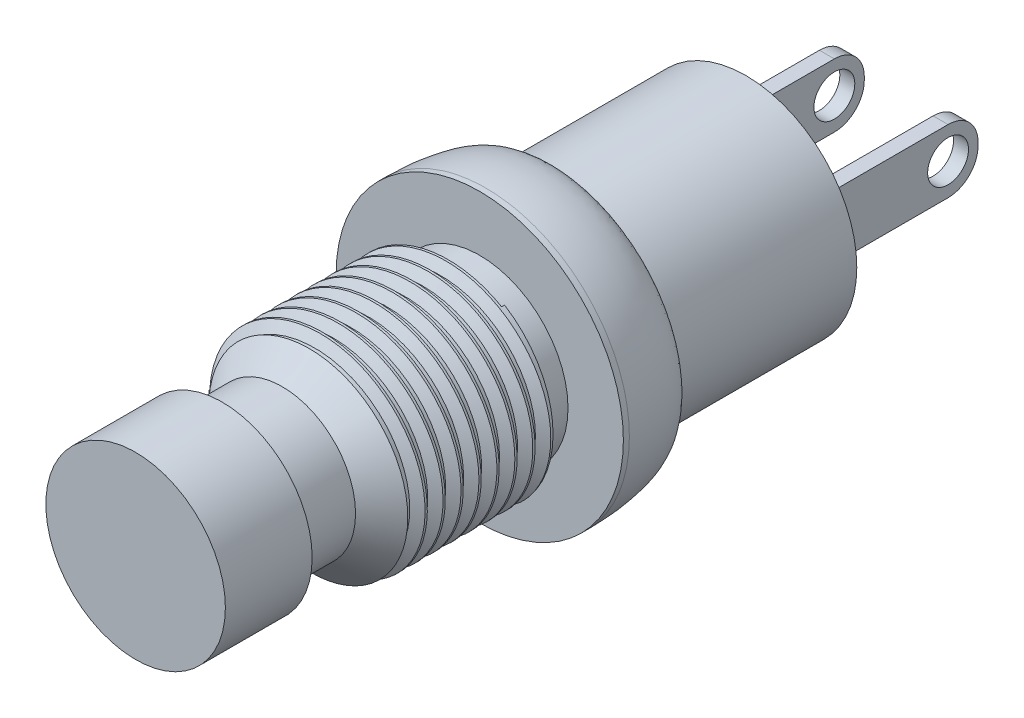
from build123d import *

# Parameters (mm, degrees)
SKETCH1_R           = 3.7
BOSS_EXTRUDE1_DEPTH = 6.5
SKETCH2_R           = 4.8
BOSS_EXTRUDE2_DEPTH = 2.4
FILLET1_SIZE        = 2.2
FILLET1_SIZE_2      = 0.5
SKETCH3_R           = 3.45
BOSS_EXTRUDE3_DEPTH = 6.6
CHAMFER1_SIZE       = 1
SKETCH9_R           = 2.45
BOSS_EXTRUDE4_DEPTH = 2
THREAD1_PITCH       = 0.6
SKETCH10_R          = 3.45
SKETCH10_R_2        = 2.95
CUT_EXTRUDE1_DEPTH  = 1
SKETCH11_R          = 3
BOSS_EXTRUDE5_DEPTH = 2.9
SKETCH12_W          = 0.5
SKETCH12_H          = 2.12
BOSS_EXTRUDE6_DEPTH = 5.6
FILLET2_R           = 1
SKETCH13_R          = 0.682843031
CUT_EXTRUDE2_DEPTH  = 5.6


with BuildPart() as part:
    # Sketch1 → Boss-Extrude1 (new body)
    with BuildSketch(Plane.XY):
        with Locations(Location((0, 0, 0), (0, 0, 180))):
            Circle(SKETCH1_R)
    extrude(amount=BOSS_EXTRUDE1_DEPTH)

    # Sketch2 → Boss-Extrude2 (add)
    with BuildSketch(Plane.XY.offset(6.5)):
        Circle(SKETCH2_R)
    extrude(amount=BOSS_EXTRUDE2_DEPTH)

    # Fillet1
    # an asymmetric fillet: 2.2, 0.5 mm, written as the material it takes off along each edge
    with BuildSketch(Plane(origin=(0, 0, 6.5), x_dir=(1, 0, 0), z_dir=(0, -1, 0))) as fillet1_piece_1:
        with BuildLine():
            Bezier((4.8, FILLET1_SIZE), (4.8, 0), (4.8 - FILLET1_SIZE_2, 0), weights=[1, 0.707106781, 1])
            Line((4.8 - FILLET1_SIZE_2, 0), (4.8, 0))
            Line((4.8, 0), (4.8, FILLET1_SIZE))
        make_face()
    revolve(axis=Axis((0, 0, 6.5), (0, 0, 1)), mode=Mode.SUBTRACT)

    # Sketch3 → Boss-Extrude3 (add)
    with BuildSketch(Plane.XY.offset(8.9)):
        Circle(SKETCH3_R)
    extrude(amount=BOSS_EXTRUDE3_DEPTH)

    # Chamfer1
    chamfer1_edges = [part.edges().sort_by_distance(p)[0] for p in [
        (-3.45, 0, 15.5),
    ]]
    chamfer(chamfer1_edges, length=CHAMFER1_SIZE)

    # Sketch9 → Boss-Extrude4 (add)
    with BuildSketch(Plane.XY.offset(15.5)):
        Circle(SKETCH9_R)
    extrude(amount=BOSS_EXTRUDE4_DEPTH)

    # Thread1: the profile of Thread Profile1 profile screwed along a right-hand helix of 8.333333 turns, 6 arcs to a turn; built about Z, then put on its axis
    thread1_z = Axis((0, 0, 0), (0, 0, 1))
    thread1_corners = [(3.4503, -1e-09, -0.000173205), (3.4503, -1e-09, 0.525173203), (3.125240475, -1e-09, 0.337499999), (3.125240475, -1e-09, 0.187499999)]
    with BuildLine(mode=Mode.PRIVATE) as thread1_profile:
        Line(thread1_corners[0], thread1_corners[1])
        Line(thread1_corners[1], thread1_corners[2])
        Line(thread1_corners[2], thread1_corners[3])
        Line(thread1_corners[3], thread1_corners[0])
    thread1_cap = Face(thread1_profile.wire())
    thread1_turn_angles = [0, 30, 60, 90, 120, 150, 180, 210, 240, 270, 300, 330, 360]
    thread1_turn_weights = [1, 0.8660254037844387, 1, 0.8660254037844387, 1, 0.8660254037844387, 1, 0.8660254037844387, 1, 0.8660254037844387, 1, 0.8660254037844387, 1]
    thread1_turn_rails = [Edge.make_bspline([Vector(p[0], p[1], 0).rotate(thread1_z, thread1_turn_angles[k]) / thread1_turn_weights[k] + Vector(0, 0, p[2] + THREAD1_PITCH * thread1_turn_angles[k] / 360) for k in range(13)], [0, 0, 0, 1, 1, 2, 2, 3, 3, 4, 4, 5, 5, 6, 6, 6], 2, thread1_turn_weights) for p in thread1_corners]
    thread1_turn_sides = [Face.make_surface_from_curves(thread1_turn_rails[p[0]], thread1_turn_rails[p[1]]) for p in [(0, 1), (1, 2), (2, 3), (3, 0)]]
    thread1_last_angles = [2880, 2910, 2940, 2970, 3000]
    thread1_last_weights = [1, 0.8660254037844387, 1, 0.8660254037844387, 1]
    thread1_last_rails = [Edge.make_bspline([Vector(p[0], p[1], 0).rotate(thread1_z, thread1_last_angles[k]) / thread1_last_weights[k] + Vector(0, 0, p[2] + THREAD1_PITCH * thread1_last_angles[k] / 360) for k in range(5)], [0, 0, 0, 1, 1, 2, 2, 2], 2, thread1_last_weights) for p in thread1_corners]
    thread1_last_sides = [Face.make_surface_from_curves(thread1_last_rails[p[0]], thread1_last_rails[p[1]]) for p in [(0, 1), (1, 2), (2, 3), (3, 0)]]
    thread1 = Plane(origin=(0, 0, 15), x_dir=(-0.999390827, 0.034899497, 0), z_dir=(0, 0, -1)) * Solid(Shell([*[p.moved(Location((0, 0, THREAD1_PITCH * i))) for i in range(8) for p in thread1_turn_sides], *thread1_last_sides, thread1_cap, thread1_cap.rotate(thread1_z, 3000).moved(Location((0, 0, THREAD1_PITCH * 3000 / 360)))]))
    add(thread1, mode=Mode.SUBTRACT)

    # Sketch10 → Cut-Extrude1 (cut)
    with BuildSketch(Plane.XY.offset(8.9)):
        Circle(SKETCH10_R)
        Circle(SKETCH10_R_2, mode=Mode.SUBTRACT)
    extrude(amount=CUT_EXTRUDE1_DEPTH, mode=Mode.SUBTRACT)

    # Sketch11 → Boss-Extrude5 (add)
    with BuildSketch(Plane.XY.offset(17.5)):
        Circle(SKETCH11_R)
    extrude(amount=BOSS_EXTRUDE5_DEPTH)

    # Sketch12 → Boss-Extrude6 (add)
    with BuildSketch(Plane(origin=(0, 0, 0), x_dir=(-1, 0, 0), z_dir=(0, 0, -1))):
        with Locations((1.9, 0)):
            Rectangle(SKETCH12_W, SKETCH12_H)
        with Locations((-1.9, 0)):
            Rectangle(SKETCH12_W, SKETCH12_H)
    extrude(amount=BOSS_EXTRUDE6_DEPTH)

    # Fillet2
    fillet2_edges = [part.edges().sort_by_distance(p)[0] for p in [
        (-1.9, 1.06, -5.6),
        (-1.9, -1.06, -5.6),
        (1.9, -1.06, -5.6),
        (1.9, 1.06, -5.6),
    ]]
    fillet(fillet2_edges, radius=FILLET2_R)

    # Sketch13 → Cut-Extrude2 (cut)
    with BuildSketch(Plane(origin=(2.15, 0, 0), x_dir=(0, 0, -1), z_dir=(1, 0, 0))):
        with Locations((4.6, 0)):
            Circle(SKETCH13_R)
    extrude(amount=-CUT_EXTRUDE2_DEPTH, mode=Mode.SUBTRACT)


solid = part.part
